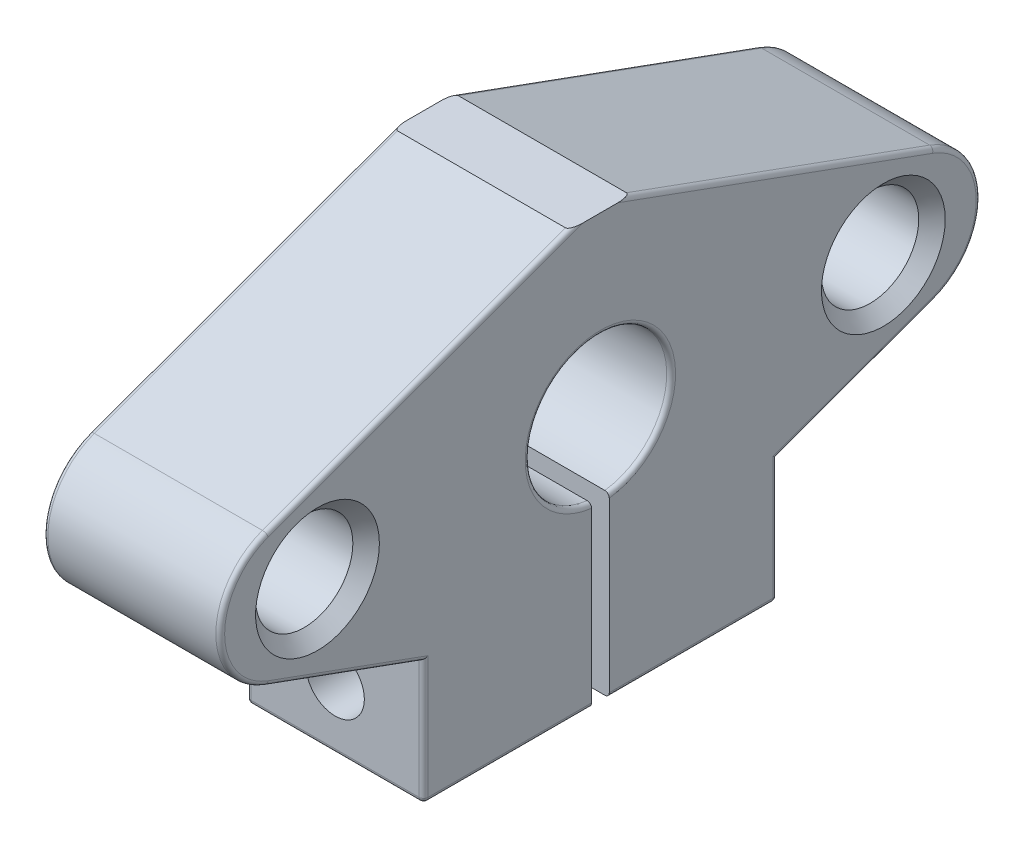
from build123d import *

# Parameters (mm, degrees)
RESSALTO_EXTRUS_O1_DEPTH                             = 10
CORTE_EXTRUS_O1_DEPTH                                = 10
ESCAREADO_PARA_PARAFUSO_DE_M_QUINA_COM_C_D           = 5.5
ESCAREADO_PARA_PARAFUSO_DE_M_QUINA_COM_C_CSINK_D     = 7
ESCAREADO_PARA_PARAFUSO_DE_M_QUINA_COM_C_CSINK_ANGLE = 90
BROCA_DE_ROSQUEAR_PARA_TARRAXA_DE_M4X0_7_D           = 3.3
FILETE1_R                                            = 0.25
FILETE2_R                                            = 0.25
FILETE3_R                                            = 0.25
FILETE4_R                                            = 0.25
FILETE5_R                                            = 0.25
FILETE6_R                                            = 0.25
FILETE7_R                                            = 0.25


with BuildPart() as part:
    # Esboço1 → Ressalto-extrusão1 (new body)
    with BuildSketch(Plane(origin=(0, 0, 0), x_dir=(0, 0, -1), z_dir=(1, 0, 0))):
        with BuildLine():
            Line((1.720443406, 24), (18.868080573, 17.758770483))
            ThreePointArc((18.868080573, 17.758770483), (21.5, 14), (18.868080573, 10.241229517))
            Line((18.868080573, 10.241229517), (10, 7.013512153))
            Line((10, 7.013512153), (10, 0))
            Line((10, 0), (-10, 0))
            Line((-10, 0), (-10, 7.013512153))
            Line((-10, 7.013512153), (-18.868080573, 10.241229517))
            ThreePointArc((-18.868080573, 10.241229517), (-21.5, 14), (-18.868080573, 17.758770483))
            Line((-18.868080573, 17.758770483), (-1.720443406, 24))
            Line((-1.720443406, 24), (1.720443406, 24))
        make_face()
    extrude(amount=-RESSALTO_EXTRUS_O1_DEPTH)

    # Esboço2 → Corte-extrusão1 (cut)
    with BuildSketch(Plane(origin=(0, 0, 0), x_dir=(0, 0, -1), z_dir=(1, 0, 0))):
        with BuildLine():
            Line((-0.5, 10.031373033), (-0.5, -0.626033642))
            Line((-0.5, -0.626033642), (0.5, -0.626033642))
            Line((0.5, -0.626033642), (0.5, 10.031373033))
            ThreePointArc((0.5, 10.031373033), (0, 18), (-0.5, 10.031373033))
        make_face()
    extrude(amount=-CORTE_EXTRUS_O1_DEPTH, mode=Mode.SUBTRACT)

    # Escareado para parafuso de máquina com cabeça chata de M51 (through all)
    with Locations(Plane(origin=(0, 0, 0), x_dir=(0, 0, -1), z_dir=(1, 0, 0))):
        with Locations((-16, 14.062464808), (16, 13.937535192)):
            CounterSinkHole(ESCAREADO_PARA_PARAFUSO_DE_M_QUINA_COM_C_D / 2, ESCAREADO_PARA_PARAFUSO_DE_M_QUINA_COM_C_CSINK_D / 2, counter_sink_angle=ESCAREADO_PARA_PARAFUSO_DE_M_QUINA_COM_C_CSINK_ANGLE)

    # Broca de rosquear para tarraxa de M4x0.71 (through all)
    with Locations(Plane(origin=(0, 0, -10), x_dir=(-1, 0, 0), z_dir=(0, 0, -1))):
        with Locations((5, 3.506756077)):
            Hole(BROCA_DE_ROSQUEAR_PARA_TARRAXA_DE_M4X0_7_D / 2)

    # Filete1
    filete1_edges = [part.edges().sort_by_distance(p)[0] for p in [
        (0, 20.879385242, -10.29426199),
        (0, 14, -21.5),
        (0, 8.627370835, -14.434040287),
    ]]
    fillet(filete1_edges, radius=FILETE1_R)

    # Filete2
    filete2_edges = [part.edges().sort_by_distance(p)[0] for p in [
        (0, 3.639778298, -10),
    ]]
    fillet(filete2_edges, radius=FILETE2_R)

    # Filete3
    filete3_edges = [part.edges().sort_by_distance(p)[0] for p in [
        (-5.125, 0, -10),
        (0, 0, -5.125),
        (-0.073223305, 0, -9.926776695),
    ]]
    fillet(filete3_edges, radius=FILETE3_R)

    # Filete4
    filete4_edges = [part.edges().sort_by_distance(p)[0] for p in [
        (0, 0, 5.25),
        (-5, 0, 10),
        (-10, 0, 5.25),
    ]]
    fillet(filete4_edges, radius=FILETE4_R)

    # Filete5
    # the kernel refuses this fillet: 0.25 mm, written as the material it takes off along each edge
    with BuildSketch(Plane(origin=(-0.25, 0.25, 9.75), x_dir=(1, 0, 0), z_dir=(0, 0, 1))) as filete5_piece_1_section:
        Polygon((0, 0), (FILETE5_R * 1.02, 0), (FILETE5_R * 1.02, -FILETE5_R * 1.02), (0, -FILETE5_R * 1.02), align=None)
    filete5_piece_1 = extrude(amount=FILETE5_R * 1.02, mode=Mode.PRIVATE)
    filete5_piece_1 = filete5_piece_1 - Plane(origin=(-0.25, 0.25, 9.75), x_dir=(-0.7071067811865475, 0.7071067811865475, 0), z_dir=(0, 0, 1)) * Sphere(FILETE5_R, mode=Mode.PRIVATE)
    add(filete5_piece_1, mode=Mode.SUBTRACT)
    with BuildSketch(Plane(origin=(0, 0.25, 10), x_dir=(-1, 0, 0), z_dir=(0, 1, 0))) as filete5_piece_2_section:
        with BuildLine():
            CenterArc((FILETE5_R, -FILETE5_R), FILETE5_R, 90, 90)
            Line((0, -FILETE5_R), (-FILETE5_R * 0.02, -FILETE5_R))
            Line((-FILETE5_R * 0.02, -FILETE5_R), (-FILETE5_R * 0.02, FILETE5_R * 0.02))
            Line((-FILETE5_R * 0.02, FILETE5_R * 0.02), (FILETE5_R, FILETE5_R * 0.02))
            Line((FILETE5_R, FILETE5_R * 0.02), (FILETE5_R, 0))
        make_face()
    filete5_piece_2 = extrude(amount=8.263512153, mode=Mode.PRIVATE)
    filete5_piece_2 = split(filete5_piece_2, bisect_by=Plane(origin=(-0.056691407, 6.598580187, 8.859983793), z_dir=(0, -0.9396926207859096, 0.3420201433256659)), keep=Keep.TOP, mode=Mode.PRIVATE)
    add(filete5_piece_2, mode=Mode.SUBTRACT)
    with BuildSketch(Plane(origin=(0, 6.500481938, 8.590461069), x_dir=(-1, 0, 0), z_dir=(0, 0.3420201433256658, 0.9396926207859094))) as filete5_piece_3_section:
        with BuildLine():
            CenterArc((FILETE5_R, -FILETE5_R), FILETE5_R, 90, 90)
            Line((0, -FILETE5_R), (-FILETE5_R * 0.02, -FILETE5_R))
            Line((-FILETE5_R * 0.02, -FILETE5_R), (-FILETE5_R * 0.02, FILETE5_R * 0.02))
            Line((-FILETE5_R * 0.02, FILETE5_R * 0.02), (FILETE5_R, FILETE5_R * 0.02))
            Line((FILETE5_R, FILETE5_R * 0.02), (FILETE5_R, 0))
        make_face()
    filete5_piece_3 = extrude(amount=10.937214231, mode=Mode.PRIVATE)
    filete5_piece_3 = split(filete5_piece_3, bisect_by=Plane(origin=(-0.056665107, 8.68396665, 10), z_dir=(0, 0, 1)), keep=Keep.TOP, mode=Mode.PRIVATE)
    add(filete5_piece_3, mode=Mode.SUBTRACT)
    with BuildSketch(Plane(origin=(0, 14, 17.5), x_dir=(0, -0.9396926207859096, 0.3420201433256654), z_dir=(0, -0.3420201433256654, -0.9396926207859096))) as filete5_piece_4:
        with BuildLine():
            CenterArc((4 - FILETE5_R, FILETE5_R), FILETE5_R, 270, 90)
            Line((4 - FILETE5_R, 0), (4 - FILETE5_R, -FILETE5_R * 0.02))
            Line((4 - FILETE5_R, -FILETE5_R * 0.02), (4 + FILETE5_R * 0.02, -FILETE5_R * 0.02))
            Line((4 + FILETE5_R * 0.02, -FILETE5_R * 0.02), (4 + FILETE5_R * 0.02, FILETE5_R))
            Line((4 + FILETE5_R * 0.02, FILETE5_R), (4, FILETE5_R))
        make_face()
    revolve(axis=Axis((0, 14, 17.5), (-1, 0, 0)), revolution_arc=140, mode=Mode.SUBTRACT)
    with BuildSketch(Plane(origin=(0, 17.758770483, 18.868080573), x_dir=(-1, 0, 0), z_dir=(0, 0.342020143325666, -0.9396926207859094))) as filete5_piece_5:
        with BuildLine():
            CenterArc((FILETE5_R, -FILETE5_R), FILETE5_R, 90, 90)
            Line((0, -FILETE5_R), (-FILETE5_R * 0.02, -FILETE5_R))
            Line((-FILETE5_R * 0.02, -FILETE5_R), (-FILETE5_R * 0.02, FILETE5_R * 0.02))
            Line((-FILETE5_R * 0.02, FILETE5_R * 0.02), (FILETE5_R, FILETE5_R * 0.02))
            Line((FILETE5_R, FILETE5_R * 0.02), (FILETE5_R, 0))
        make_face()
    extrude(amount=19.748134324, mode=Mode.SUBTRACT)
    with BuildSketch(Plane(origin=(0, 0.25, 10), x_dir=(-1, 0, 0), z_dir=(0, 1, 0))) as filete5_piece_6a_section:
        with BuildLine():
            CenterArc((FILETE5_R, -FILETE5_R), FILETE5_R, 90, 90)
            Line((0, -FILETE5_R), (-FILETE5_R * 0.02, -FILETE5_R))
            Line((-FILETE5_R * 0.02, -FILETE5_R), (-FILETE5_R * 0.02, FILETE5_R * 0.02))
            Line((-FILETE5_R * 0.02, FILETE5_R * 0.02), (FILETE5_R, FILETE5_R * 0.02))
            Line((FILETE5_R, FILETE5_R * 0.02), (FILETE5_R, 0))
        make_face()
    filete5_piece_6a = extrude(amount=8.263512153, mode=Mode.PRIVATE)
    filete5_piece_6a = split(filete5_piece_6a, bisect_by=Plane(origin=(-0.056188027, 7.08161184, 10.187102353), z_dir=(0, 0.9396926207859096, -0.3420201433256659)), keep=Keep.TOP, mode=Mode.PRIVATE)
    with BuildSketch(Plane(origin=(0, 6.500481938, 8.590461069), x_dir=(-1, 0, 0), z_dir=(0, 0.3420201433256658, 0.9396926207859094))) as filete5_piece_6b_section:
        with BuildLine():
            CenterArc((FILETE5_R, -FILETE5_R), FILETE5_R, 90, 90)
            Line((0, -FILETE5_R), (-FILETE5_R * 0.02, -FILETE5_R))
            Line((-FILETE5_R * 0.02, -FILETE5_R), (-FILETE5_R * 0.02, FILETE5_R * 0.02))
            Line((-FILETE5_R * 0.02, FILETE5_R * 0.02), (FILETE5_R, FILETE5_R * 0.02))
            Line((FILETE5_R, FILETE5_R * 0.02), (FILETE5_R, 0))
        make_face()
    filete5_piece_6b = extrude(amount=10.937214231, mode=Mode.PRIVATE)
    filete5_piece_6b = split(filete5_piece_6b, bisect_by=Plane(origin=(-0.056188027, 6.814401988, 10), z_dir=(0, 0, -1)), keep=Keep.TOP, mode=Mode.PRIVATE)
    filete5_piece_6 = filete5_piece_6a & filete5_piece_6b
    add(filete5_piece_6, mode=Mode.SUBTRACT)

    # Filete6
    # the kernel refuses this fillet: 0.25 mm, written as the material it takes off along each edge
    with BuildSketch(Plane(origin=(-9.75, 0.25, 9.75), x_dir=(0, 0, 1), z_dir=(-1, 0, 0))) as filete6_piece_1_section:
        Polygon((0, 0), (FILETE6_R * 1.02, 0), (FILETE6_R * 1.02, -FILETE6_R * 1.02), (0, -FILETE6_R * 1.02), align=None)
    filete6_piece_1 = extrude(amount=FILETE6_R * 1.02, mode=Mode.PRIVATE)
    filete6_piece_1 = filete6_piece_1 - Plane(origin=(-9.75, 0.25, 9.75), x_dir=(0, 0.7071067811865475, -0.7071067811865475), z_dir=(-1, 0, 0)) * Sphere(FILETE6_R, mode=Mode.PRIVATE)
    add(filete6_piece_1, mode=Mode.SUBTRACT)
    with BuildSketch(Plane(origin=(-10, 17.758770483, 18.868080573), x_dir=(0, -0.9396926207859094, -0.34202014332566594), z_dir=(0, 0.342020143325666, -0.9396926207859094)), Plane(origin=(-10, 24.513030215, -0.310904475), x_dir=(0, -0.9396926207859094, 0.342020143325666), z_dir=(0, -0.342020143325666, -0.9396926207859094))) as filete6_piece_2:
        with BuildLine():
            CenterArc((FILETE6_R, -FILETE6_R), FILETE6_R, 90, 90)
            Line((0, -FILETE6_R), (-FILETE6_R * 0.02, -FILETE6_R))
            Line((-FILETE6_R * 0.02, -FILETE6_R), (-FILETE6_R * 0.02, FILETE6_R * 0.02))
            Line((-FILETE6_R * 0.02, FILETE6_R * 0.02), (FILETE6_R, FILETE6_R * 0.02))
            Line((FILETE6_R, FILETE6_R * 0.02), (FILETE6_R, 0))
        make_face()
    extrude(amount=19.748134324, mode=Mode.SUBTRACT)
    with BuildSketch(Plane(origin=(-10, 14, 17.5), x_dir=(0, -0.9396926207859096, 0.3420201433256654), z_dir=(0, -0.3420201433256654, -0.9396926207859096))) as filete6_piece_3:
        with BuildLine():
            CenterArc((4 - FILETE6_R, -FILETE6_R), FILETE6_R, 0, 90)
            Line((4, -FILETE6_R), (4 + FILETE6_R * 0.02, -FILETE6_R))
            Line((4 + FILETE6_R * 0.02, -FILETE6_R), (4 + FILETE6_R * 0.02, FILETE6_R * 0.02))
            Line((4 + FILETE6_R * 0.02, FILETE6_R * 0.02), (4 - FILETE6_R, FILETE6_R * 0.02))
            Line((4 - FILETE6_R, FILETE6_R * 0.02), (4 - FILETE6_R, 0))
        make_face()
    revolve(axis=Axis((-10, 14, 17.5), (-1, 0, 0)), revolution_arc=140, mode=Mode.SUBTRACT)
    with BuildSketch(Plane(origin=(-10, 6.500481938, 8.590461069), x_dir=(0, 0.9396926207859094, -0.3420201433256658), z_dir=(0, 0.3420201433256658, 0.9396926207859094))) as filete6_piece_4_section:
        with BuildLine():
            CenterArc((FILETE6_R, -FILETE6_R), FILETE6_R, 90, 90)
            Line((0, -FILETE6_R), (-FILETE6_R * 0.02, -FILETE6_R))
            Line((-FILETE6_R * 0.02, -FILETE6_R), (-FILETE6_R * 0.02, FILETE6_R * 0.02))
            Line((-FILETE6_R * 0.02, FILETE6_R * 0.02), (FILETE6_R, FILETE6_R * 0.02))
            Line((FILETE6_R, FILETE6_R * 0.02), (FILETE6_R, 0))
        make_face()
    filete6_piece_4 = extrude(amount=10.937214231, mode=Mode.PRIVATE)
    filete6_piece_4 = split(filete6_piece_4, bisect_by=Plane(origin=(-9.943334893, 8.68396665, 10), z_dir=(0, 0, 1)), keep=Keep.TOP, mode=Mode.PRIVATE)
    add(filete6_piece_4, mode=Mode.SUBTRACT)
    with BuildSketch(Plane(origin=(-10, 0.25, 10), x_dir=(0, 0, -1), z_dir=(0, 1, 0))) as filete6_piece_5_section:
        with BuildLine():
            CenterArc((FILETE6_R, -FILETE6_R), FILETE6_R, 90, 90)
            Line((0, -FILETE6_R), (-FILETE6_R * 0.02, -FILETE6_R))
            Line((-FILETE6_R * 0.02, -FILETE6_R), (-FILETE6_R * 0.02, FILETE6_R * 0.02))
            Line((-FILETE6_R * 0.02, FILETE6_R * 0.02), (FILETE6_R, FILETE6_R * 0.02))
            Line((FILETE6_R, FILETE6_R * 0.02), (FILETE6_R, 0))
        make_face()
    filete6_piece_5 = extrude(amount=8.263512153, mode=Mode.PRIVATE)
    filete6_piece_5 = split(filete6_piece_5, bisect_by=Plane(origin=(-9.943308593, 6.598580187, 8.859983793), z_dir=(0, -0.9396926207859096, 0.3420201433256659)), keep=Keep.TOP, mode=Mode.PRIVATE)
    add(filete6_piece_5, mode=Mode.SUBTRACT)
    with BuildSketch(Plane(origin=(-10, 0, -9.75), x_dir=(0, 1, 0), z_dir=(0, 0, 1))) as filete6_piece_6:
        with BuildLine():
            CenterArc((FILETE6_R, -FILETE6_R), FILETE6_R, 90, 90)
            Line((0, -FILETE6_R), (-FILETE6_R * 0.02, -FILETE6_R))
            Line((-FILETE6_R * 0.02, -FILETE6_R), (-FILETE6_R * 0.02, FILETE6_R * 0.02))
            Line((-FILETE6_R * 0.02, FILETE6_R * 0.02), (FILETE6_R, FILETE6_R * 0.02))
            Line((FILETE6_R, FILETE6_R * 0.02), (FILETE6_R, 0))
        make_face()
    extrude(amount=10.75, mode=Mode.SUBTRACT)
    with BuildSketch(Plane(origin=(-10, 10.241229517, -18.868080573), x_dir=(0, 0.9396926207859094, 0.34202014332566577), z_dir=(0, -0.3420201433256658, 0.9396926207859094))) as filete6_piece_7_section:
        with BuildLine():
            CenterArc((FILETE6_R, -FILETE6_R), FILETE6_R, 90, 90)
            Line((0, -FILETE6_R), (-FILETE6_R * 0.02, -FILETE6_R))
            Line((-FILETE6_R * 0.02, -FILETE6_R), (-FILETE6_R * 0.02, FILETE6_R * 0.02))
            Line((-FILETE6_R * 0.02, FILETE6_R * 0.02), (FILETE6_R, FILETE6_R * 0.02))
            Line((FILETE6_R, FILETE6_R * 0.02), (FILETE6_R, 0))
        make_face()
    filete6_piece_7 = extrude(amount=10.937214231, mode=Mode.PRIVATE)
    filete6_piece_7 = split(filete6_piece_7, bisect_by=Plane(origin=(-9.943334893, 8.68396665, -10), z_dir=(0, 0, -1)), keep=Keep.TOP, mode=Mode.PRIVATE)
    add(filete6_piece_7, mode=Mode.SUBTRACT)
    with BuildSketch(Plane(origin=(-10, 14, -17.5), x_dir=(0, 0.9396926207859096, -0.3420201433256654), z_dir=(0, 0.3420201433256654, 0.9396926207859096))) as filete6_piece_8:
        with BuildLine():
            CenterArc((4 - FILETE6_R, -FILETE6_R), FILETE6_R, 0, 90)
            Line((4, -FILETE6_R), (4 + FILETE6_R * 0.02, -FILETE6_R))
            Line((4 + FILETE6_R * 0.02, -FILETE6_R), (4 + FILETE6_R * 0.02, FILETE6_R * 0.02))
            Line((4 + FILETE6_R * 0.02, FILETE6_R * 0.02), (4 - FILETE6_R, FILETE6_R * 0.02))
            Line((4 - FILETE6_R, FILETE6_R * 0.02), (4 - FILETE6_R, 0))
        make_face()
    revolve(axis=Axis((-10, 14, -17.5), (-1, 0, 0)), revolution_arc=140, mode=Mode.SUBTRACT)
    with BuildSketch(Plane(origin=(-10, 8.513512153, -10), x_dir=(0, 0, 1), z_dir=(0, -1, 0))) as filete6_piece_9_section:
        with BuildLine():
            CenterArc((FILETE6_R, -FILETE6_R), FILETE6_R, 90, 90)
            Line((0, -FILETE6_R), (-FILETE6_R * 0.02, -FILETE6_R))
            Line((-FILETE6_R * 0.02, -FILETE6_R), (-FILETE6_R * 0.02, FILETE6_R * 0.02))
            Line((-FILETE6_R * 0.02, FILETE6_R * 0.02), (FILETE6_R, FILETE6_R * 0.02))
            Line((FILETE6_R, FILETE6_R * 0.02), (FILETE6_R, 0))
        make_face()
    filete6_piece_9 = extrude(amount=8.263512153, mode=Mode.PRIVATE)
    filete6_piece_9 = split(filete6_piece_9, bisect_by=Plane(origin=(-9.943308593, 6.598580187, -8.859983793), z_dir=(0, -0.9396926207859096, -0.3420201433256659)), keep=Keep.TOP, mode=Mode.PRIVATE)
    add(filete6_piece_9, mode=Mode.SUBTRACT)
    with BuildSketch(Plane(origin=(-10, 0.25, -9.75), x_dir=(0, 0, -1), z_dir=(0, 1, 0))) as filete6_piece_10:
        with BuildLine():
            CenterArc((0.25 - FILETE6_R, -FILETE6_R), FILETE6_R, 0, 90)
            Line((0.25, -FILETE6_R), (0.25 + FILETE6_R * 0.02, -FILETE6_R))
            Line((0.25 + FILETE6_R * 0.02, -FILETE6_R), (0.25 + FILETE6_R * 0.02, 0))
            Line((0.25 + FILETE6_R * 0.02, 0), (0.25, FILETE6_R * 0.02))
            Line((0.25, FILETE6_R * 0.02), (0.25 - FILETE6_R, FILETE6_R * 0.02))
            Line((0.25 - FILETE6_R, FILETE6_R * 0.02), (0.25 - FILETE6_R, 0))
        make_face()
    revolve(axis=Axis((-10, 0.25, -9.75), (-1, 0, 0)), revolution_arc=90, mode=Mode.SUBTRACT)
    with BuildSketch(Plane(origin=(-10, 0.25, 10), x_dir=(0, 0, -1), z_dir=(0, 1, 0))) as filete6_piece_11a_section:
        with BuildLine():
            CenterArc((FILETE6_R, -FILETE6_R), FILETE6_R, 90, 90)
            Line((0, -FILETE6_R), (-FILETE6_R * 0.02, -FILETE6_R))
            Line((-FILETE6_R * 0.02, -FILETE6_R), (-FILETE6_R * 0.02, FILETE6_R * 0.02))
            Line((-FILETE6_R * 0.02, FILETE6_R * 0.02), (FILETE6_R, FILETE6_R * 0.02))
            Line((FILETE6_R, FILETE6_R * 0.02), (FILETE6_R, 0))
        make_face()
    filete6_piece_11a = extrude(amount=8.263512153, mode=Mode.PRIVATE)
    filete6_piece_11a = split(filete6_piece_11a, bisect_by=Plane(origin=(-9.943811973, 7.08161184, 10.187102353), z_dir=(0, 0.9396926207859096, -0.3420201433256659)), keep=Keep.TOP, mode=Mode.PRIVATE)
    with BuildSketch(Plane(origin=(-10, 6.500481938, 8.590461069), x_dir=(0, 0.9396926207859094, -0.3420201433256658), z_dir=(0, 0.3420201433256658, 0.9396926207859094))) as filete6_piece_11b_section:
        with BuildLine():
            CenterArc((FILETE6_R, -FILETE6_R), FILETE6_R, 90, 90)
            Line((0, -FILETE6_R), (-FILETE6_R * 0.02, -FILETE6_R))
            Line((-FILETE6_R * 0.02, -FILETE6_R), (-FILETE6_R * 0.02, FILETE6_R * 0.02))
            Line((-FILETE6_R * 0.02, FILETE6_R * 0.02), (FILETE6_R, FILETE6_R * 0.02))
            Line((FILETE6_R, FILETE6_R * 0.02), (FILETE6_R, 0))
        make_face()
    filete6_piece_11b = extrude(amount=10.937214231, mode=Mode.PRIVATE)
    filete6_piece_11b = split(filete6_piece_11b, bisect_by=Plane(origin=(-9.943811973, 6.814401988, 10), z_dir=(0, 0, -1)), keep=Keep.TOP, mode=Mode.PRIVATE)
    filete6_piece_11 = filete6_piece_11a & filete6_piece_11b
    add(filete6_piece_11, mode=Mode.SUBTRACT)
    with BuildSketch(Plane(origin=(-10, 8.513512153, -10), x_dir=(0, 0, 1), z_dir=(0, -1, 0))) as filete6_piece_12a_section:
        with BuildLine():
            CenterArc((FILETE6_R, -FILETE6_R), FILETE6_R, 90, 90)
            Line((0, -FILETE6_R), (-FILETE6_R * 0.02, -FILETE6_R))
            Line((-FILETE6_R * 0.02, -FILETE6_R), (-FILETE6_R * 0.02, FILETE6_R * 0.02))
            Line((-FILETE6_R * 0.02, FILETE6_R * 0.02), (FILETE6_R, FILETE6_R * 0.02))
            Line((FILETE6_R, FILETE6_R * 0.02), (FILETE6_R, 0))
        make_face()
    filete6_piece_12a = extrude(amount=8.263512153, mode=Mode.PRIVATE)
    filete6_piece_12a = split(filete6_piece_12a, bisect_by=Plane(origin=(-9.943811973, 7.08161184, -10.187102353), z_dir=(0, 0.9396926207859096, 0.3420201433256659)), keep=Keep.TOP, mode=Mode.PRIVATE)
    with BuildSketch(Plane(origin=(-10, 10.241229517, -18.868080573), x_dir=(0, 0.9396926207859094, 0.34202014332566577), z_dir=(0, -0.3420201433256658, 0.9396926207859094))) as filete6_piece_12b_section:
        with BuildLine():
            CenterArc((FILETE6_R, -FILETE6_R), FILETE6_R, 90, 90)
            Line((0, -FILETE6_R), (-FILETE6_R * 0.02, -FILETE6_R))
            Line((-FILETE6_R * 0.02, -FILETE6_R), (-FILETE6_R * 0.02, FILETE6_R * 0.02))
            Line((-FILETE6_R * 0.02, FILETE6_R * 0.02), (FILETE6_R, FILETE6_R * 0.02))
            Line((FILETE6_R, FILETE6_R * 0.02), (FILETE6_R, 0))
        make_face()
    filete6_piece_12b = extrude(amount=10.937214231, mode=Mode.PRIVATE)
    filete6_piece_12b = split(filete6_piece_12b, bisect_by=Plane(origin=(-9.943811973, 6.814401988, -10), z_dir=(0, 0, 1)), keep=Keep.TOP, mode=Mode.PRIVATE)
    filete6_piece_12 = filete6_piece_12a & filete6_piece_12b
    add(filete6_piece_12, mode=Mode.SUBTRACT)

    # Filete7
    filete7_edges = [part.edges().sort_by_distance(p)[0] for p in [
        (-10, 18, 0),
        (0, 18, 0),
    ]]
    fillet(filete7_edges, radius=FILETE7_R)


solid = part.part
